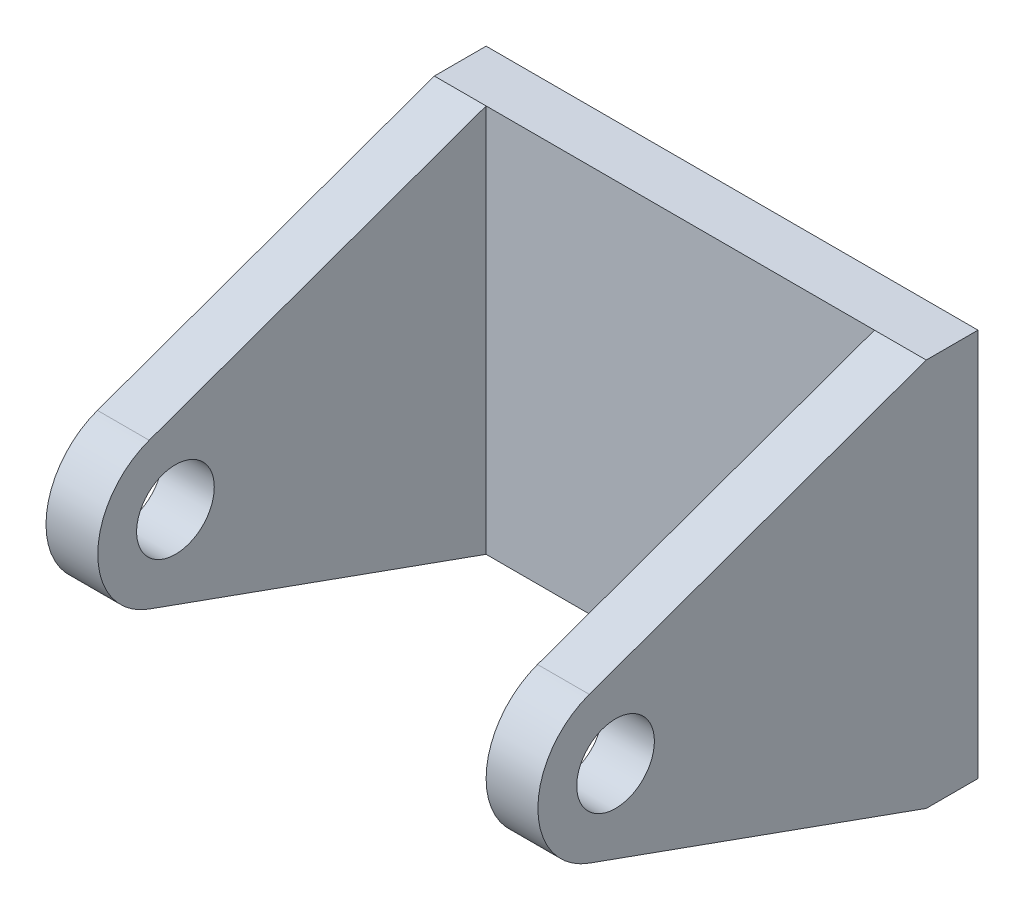
from build123d import *

# Parameters (mm, degrees)
SKETCH1_R           = 7.5
BOSS_EXTRUDE1_DEPTH = 10
SKETCH2_W           = 95
SKETCH2_H           = 75
BOSS_EXTRUDE2_DEPTH = 10
LPATTERN1_COUNT     = 2
LPATTERN1_PITCH     = 85


with BuildPart() as part:
    # Sketch1 → Boss-Extrude1 (new body)
    with BuildSketch(Plane.YZ):
        with BuildLine():
            Line((-14.116239718, 5.072649824), (-37.5, -60))
            Line((-37.5, -60), (37.5, -60))
            Line((37.5, -60), (14.116239718, 5.072649824))
            ThreePointArc((14.116239718, 5.072649824), (0, 15), (-14.116239718, 5.072649824))
        make_face()
        Circle(SKETCH1_R, mode=Mode.SUBTRACT)
    boss_extrude1 = extrude(amount=BOSS_EXTRUDE1_DEPTH)

    # Sketch2 → Boss-Extrude2 (add)
    with BuildSketch(Plane(origin=(0, 0, -60), x_dir=(1, 0, 0), z_dir=(0, 0, -1))):
        with Locations((47.5, 0)):
            Rectangle(SKETCH2_W, SKETCH2_H)
    extrude(amount=BOSS_EXTRUDE2_DEPTH)

    # LPattern1: Boss-Extrude1 ×2
    with Locations(*[(i * LPATTERN1_PITCH, 0, 0) for i in range(1, LPATTERN1_COUNT)]):
        add(boss_extrude1)


solid = part.part
